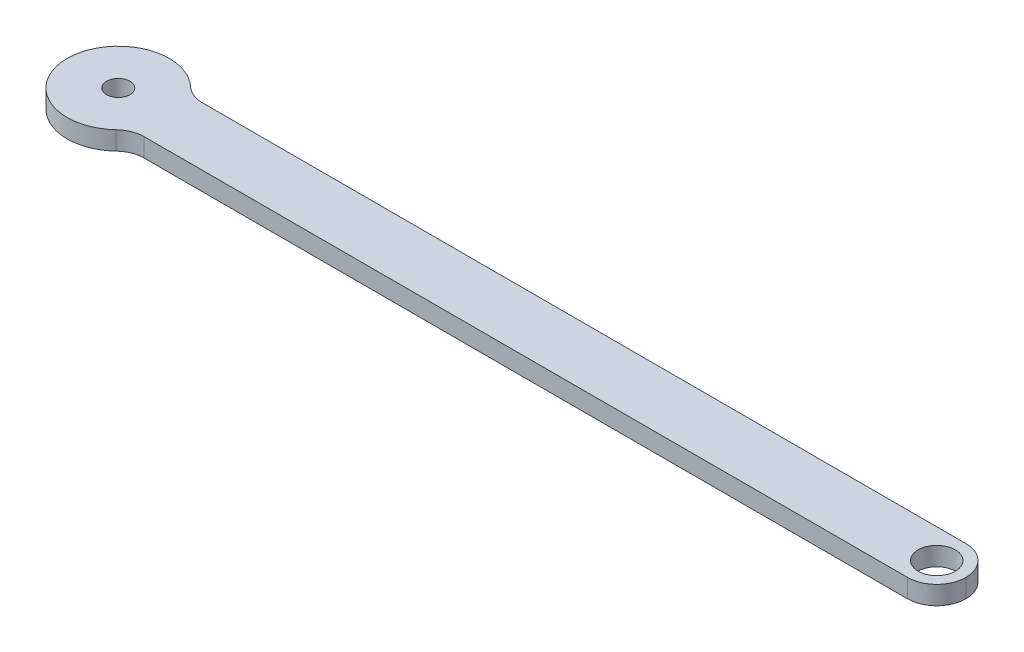
from build123d import *

# Parameters (mm, degrees)
SKETCH1_W           = 300
SKETCH1_H           = 20
BOSS_EXTRUDE1_DEPTH = 6.35
SKETCH2_R           = 6.35
CUT_EXTRUDE1_DEPTH  = 6.35
CONG_1_R            = 10
SKETCH3_R           = 17.5
SKETCH3_R_2         = 4
BOSS_EXTRUDE2_DEPTH = 6.35
FILLET2_R           = 10


with BuildPart() as part:
    # Sketch1 → Boss-Extrude1 (new body)
    with BuildSketch(Plane(origin=(0, 0, 0), x_dir=(1, 0, 0), z_dir=(0, 1, 0))):
        Rectangle(SKETCH1_W, SKETCH1_H)
    extrude(amount=BOSS_EXTRUDE1_DEPTH)

    # Sketch2 → Cut-Extrude1 (cut)
    with BuildSketch(Plane(origin=(0, 0, 0), x_dir=(-1, 0, 0), z_dir=(0, -1, 0))):
        with Locations(Location((140, 0, 0), (0, 0, 90))):
            Circle(SKETCH2_R)
    cut_extrude1 = extrude(amount=-CUT_EXTRUDE1_DEPTH, mode=Mode.SUBTRACT)

    # Mirror1: Cut-Extrude1 across plane
    add(cut_extrude1.mirror(Plane(origin=(0, 0, 0), x_dir=(0, 0, 1), z_dir=(1, 0, 0))), mode=Mode.SUBTRACT)

    # Congé1
    cong_1_edges = [part.edges().sort_by_distance(p)[0] for p in [
        (-150, 3.175, -10),
        (-150, 3.175, 10),
        (150, 3.175, -10),
        (150, 3.175, 10),
    ]]
    fillet(cong_1_edges, radius=CONG_1_R - 0.0001)  # a hair under: the kernel refuses the full size

    # Sketch3 → Boss-Extrude2 (add)
    with BuildSketch(Plane(origin=(0, 6.35, 0), x_dir=(1, 0, 0), z_dir=(0, 1, 0))):
        with Locations((-140, 0)):
            Circle(SKETCH3_R)
        with Locations(Location((-140, 0, 0), (0, 0, 270))):
            Circle(SKETCH3_R_2, mode=Mode.SUBTRACT)
    extrude(amount=-BOSS_EXTRUDE2_DEPTH)

    # Fillet2
    fillet2_edges = [part.edges().sort_by_distance(p)[0] for p in [
        (-125.638593384, 3.175, 10),
        (-125.638593384, 3.175, -10),
    ]]
    fillet(fillet2_edges, radius=FILLET2_R)


solid = part.part
